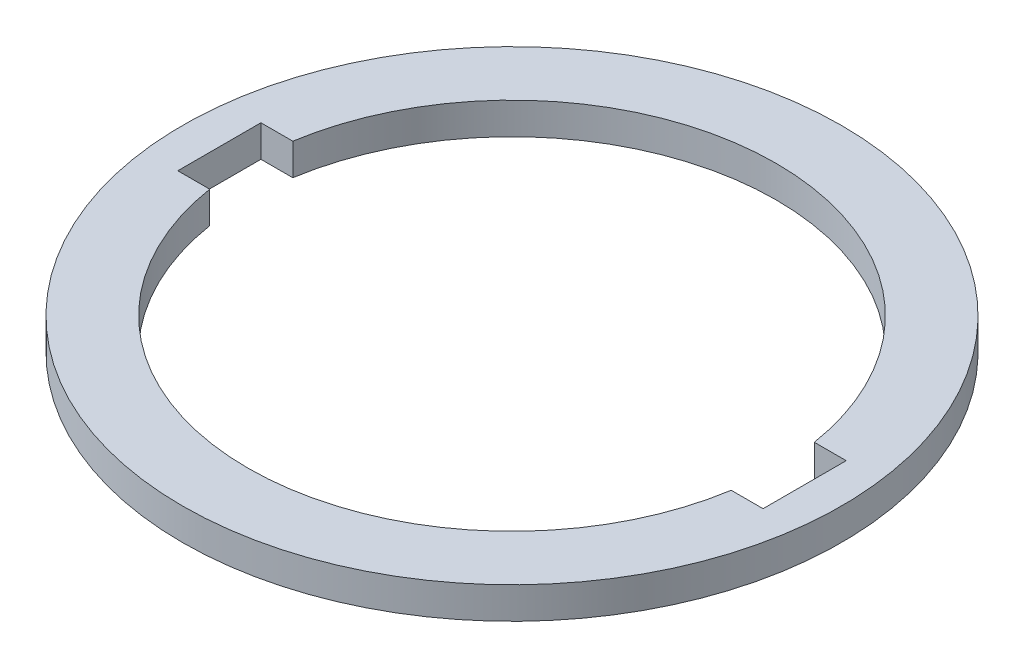
from build123d import *

# Parameters (mm, degrees)
SKETCH2_R           = 49.55
SKETCH2_R_2         = 39.7
BOSS_EXTRUDE1_DEPTH = 4.7625
SKETCH3_W           = 88
SKETCH3_H           = 12.5
CUT_EXTRUDE1_DEPTH  = 71.235933868


with BuildPart() as part:
    # Sketch2 → Boss-Extrude1 (new body)
    with BuildSketch(Plane(origin=(0, 0, 0), x_dir=(1, 0, 0), z_dir=(0, 1, 0))):
        Circle(SKETCH2_R)
        Circle(SKETCH2_R_2, mode=Mode.SUBTRACT)
    extrude(amount=BOSS_EXTRUDE1_DEPTH)

    # Sketch3 → Cut-Extrude1 (cut, through all)
    with BuildSketch(Plane(origin=(0, 4.7625, 0), x_dir=(1, 0, 0), z_dir=(0, 1, 0))):
        Rectangle(SKETCH3_W, SKETCH3_H)
    extrude(amount=-CUT_EXTRUDE1_DEPTH, mode=Mode.SUBTRACT)


solid = part.part
